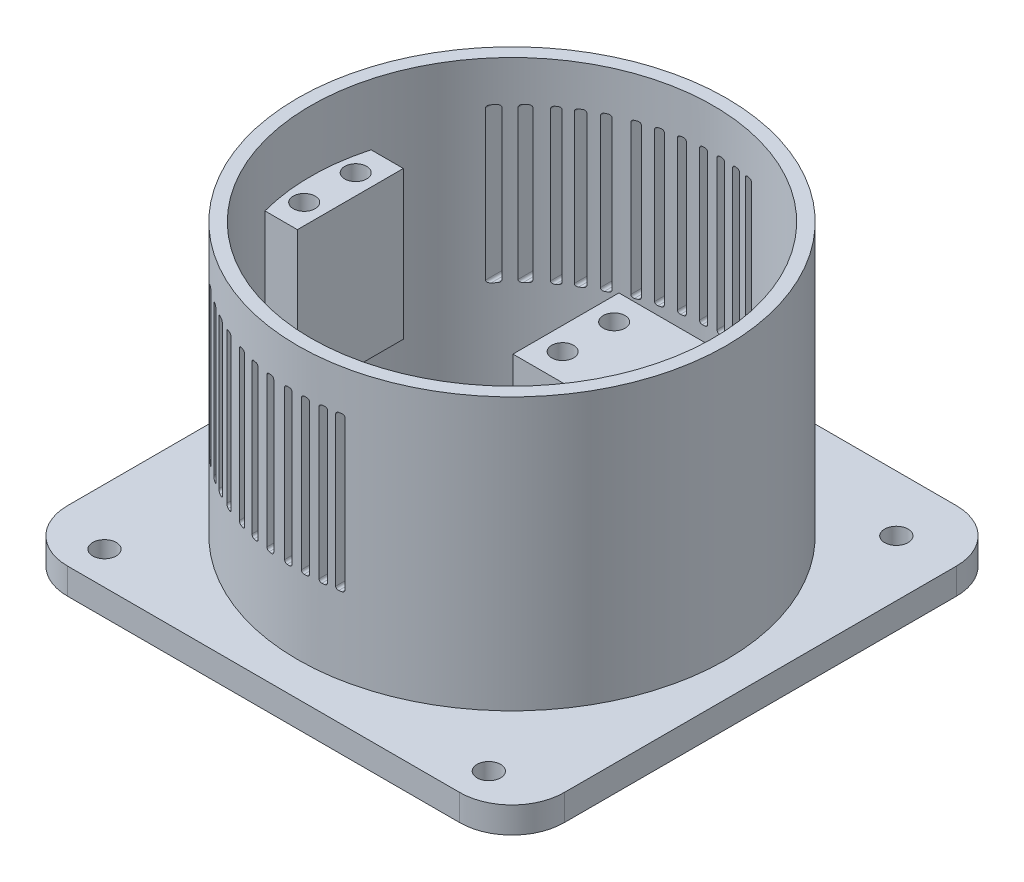
from build123d import *

# Parameters (mm, degrees)
SKETCH1_R               = 2.25
BOSS_EXTRUDE1_DEPTH     = 5
SKETCH2_R               = 41
BOSS_EXTRUDE2_DEPTH     = 52
SKETCH3_R               = 38.5
CUT_EXTRUDE1_DEPTH      = 89.099375707
BOSS_EXTRUDE3_START     = 28.28
BOSS_EXTRUDE3_DEPTH     = 28.28
SKETCH5_R               = 2.1
CUT_EXTRUDE2_DEPTH      = 5.5
SKETCH6_W               = 13.431108964
SKETCH6_H               = 20.261863373
CUT_EXTRUDE3_DEPTH      = 15
CHAMFER1_SIZE           = 5
FILLET2_R               = 10
CUT_EXTRUDE5_DEPTH      = 89.099375707
CUT_EXTRUDE5_DEPTH_BACK = 89.099375707


with BuildPart() as part:
    # Sketch1 → Boss-Extrude1 (new body)
    with BuildSketch(Plane(origin=(0, 0, 0), x_dir=(1, 0, 0), z_dir=(0, 1, 0))):
        with BuildLine():
            Line((37.5, 47.5), (-37.5, 47.5))
            ThreePointArc((-37.5, 47.5), (-44.571067812, 44.571067812), (-47.5, 37.5))
            Line((-47.5, 37.5), (-47.5, -37.5))
            ThreePointArc((-47.5, -37.5), (-44.571067812, -44.571067812), (-37.5, -47.5))
            Line((-37.5, -47.5), (37.5, -47.5))
            ThreePointArc((37.5, -47.5), (44.571067812, -44.571067812), (47.5, -37.5))
            Line((47.5, -37.5), (47.5, 37.5))
            ThreePointArc((47.5, 37.5), (44.571067812, 44.571067812), (37.5, 47.5))
        make_face()
        with Locations((-36.75, -41.181487247)):
            Circle(SKETCH1_R, mode=Mode.SUBTRACT)
        with Locations((36.75, -41.181487247)):
            Circle(SKETCH1_R, mode=Mode.SUBTRACT)
        with Locations((-36.75, 36.75)):
            Circle(SKETCH1_R, mode=Mode.SUBTRACT)
        with Locations((36.75, 36.75)):
            Circle(SKETCH1_R, mode=Mode.SUBTRACT)
    extrude(amount=BOSS_EXTRUDE1_DEPTH)

    # Sketch2 → Boss-Extrude2 (add)
    with BuildSketch(Plane(origin=(0, 5, 0), x_dir=(1, 0, 0), z_dir=(0, 1, 0))):
        Circle(SKETCH2_R)
    extrude(amount=BOSS_EXTRUDE2_DEPTH)

    # Sketch3 → Cut-Extrude1 (cut, through all)
    with BuildSketch(Plane(origin=(0, 57, 0), x_dir=(1, 0, 0), z_dir=(0, 1, 0))):
        Circle(SKETCH3_R)
    extrude(amount=-CUT_EXTRUDE1_DEPTH, mode=Mode.SUBTRACT)

    # Sketch4 → Boss-Extrude3 (add)
    with BuildSketch(Plane(origin=(0, 17, 0), x_dir=(1, 0, 0), z_dir=(0, 1, 0)).offset(BOSS_EXTRUDE3_START)):
        with BuildLine():
            Line((10.269191501, 10.173909465), (10.269191501, -10.087953908))
            Line((10.269191501, -10.087953908), (37.154854137, -10.087953908))
            ThreePointArc((37.154854137, -10.087953908), (38.499974227, 0.044547761), (37.131409429, 10.173909465))
            Line((37.131409429, 10.173909465), (10.269191501, 10.173909465))
        make_face()
        with BuildLine():
            Line((-37.154854137, -10.087953908), (-30.95381168, -10.087953908))
            Line((-30.95381168, -10.087953908), (-30.95381168, 10.173909465))
            Line((-30.95381168, 10.173909465), (-37.131409429, 10.173909465))
            ThreePointArc((-37.131409429, 10.173909465), (-38.499974227, 0.044547761), (-37.154854137, -10.087953908))
        make_face()
    extrude(amount=-BOSS_EXTRUDE3_DEPTH)

    # Sketch5 → Cut-Extrude2 (cut)
    with BuildSketch(Plane(origin=(0, 45.28, 0), x_dir=(1, 0, 0), z_dir=(0, 1, 0))):
        with Locations((14.611145618, 4.925)):
            Circle(SKETCH5_R)
        with Locations((14.611145618, -4.925)):
            Circle(SKETCH5_R)
        with Locations((-34.811145618, 4.925)):
            Circle(SKETCH5_R)
        with Locations((-34.811145618, -4.925)):
            Circle(SKETCH5_R)
    extrude(amount=-CUT_EXTRUDE2_DEPTH, mode=Mode.SUBTRACT)

    # Sketch6 → Cut-Extrude3 (cut)
    with BuildSketch(Plane(origin=(0, 17, 0), x_dir=(1, 0, 0), z_dir=(0, 1, 0))):
        with Locations((16.984745983, 0.042977779)):
            Rectangle(SKETCH6_W, SKETCH6_H)
    extrude(amount=CUT_EXTRUDE3_DEPTH, mode=Mode.SUBTRACT)

    # Chamfer1
    chamfer1_edges = [part.edges().sort_by_distance(p)[0] for p in [
        (10.269191501, 32, -0.042977779),
    ]]
    chamfer(chamfer1_edges, length=CHAMFER1_SIZE)

    # Fillet2
    fillet2_edges = [part.edges().sort_by_distance(p)[0] for p in [
        (15.269191501, 32, -0.042977779),
    ]]
    fillet(fillet2_edges, radius=FILLET2_R)

    # Sketch8 → Cut-Extrude5 (cut, two sides: drawn at the far end of the back side and taken through both)
    with BuildSketch(Plane.XY.offset(-CUT_EXTRUDE5_DEPTH_BACK)):
        with BuildLine():
            Line((-20.60603851, 48.741194653), (-20.60603851, 20.241194653))
            ThreePointArc((-20.60603851, 20.241194653), (-20.4595919, 19.887641263), (-20.10603851, 19.741194653))
            Line((-20.10603851, 19.741194653), (-19.60603851, 19.741194653))
            ThreePointArc((-19.60603851, 19.741194653), (-19.252485119, 19.887641263), (-19.10603851, 20.241194653))
            Line((-19.10603851, 20.241194653), (-19.10603851, 48.741194653))
            ThreePointArc((-19.10603851, 48.741194653), (-19.252485119, 49.094748044), (-19.60603851, 49.241194653))
            Line((-19.60603851, 49.241194653), (-20.10603851, 49.241194653))
            ThreePointArc((-20.10603851, 49.241194653), (-20.4595919, 49.094748044), (-20.60603851, 48.741194653))
        make_face()
        with BuildLine():
            Line((-22.797902435, 49.241194653), (-22.497902435, 49.241194653))
            ThreePointArc((-22.497902435, 49.241194653), (-22.144349044, 49.094748044), (-21.997902435, 48.741194653))
            Line((-21.997902435, 48.741194653), (-21.997902435, 20.241194653))
            ThreePointArc((-21.997902435, 20.241194653), (-22.144349044, 19.887641263), (-22.497902435, 19.741194653))
            Line((-22.497902435, 19.741194653), (-22.797902435, 19.741194653))
            ThreePointArc((-22.797902435, 19.741194653), (-23.151455826, 19.887641263), (-23.297902435, 20.241194653))
            Line((-23.297902435, 20.241194653), (-23.297902435, 48.741194653))
            ThreePointArc((-23.297902435, 48.741194653), (-23.151455826, 49.094748044), (-22.797902435, 49.241194653))
        make_face()
        with BuildLine():
            Line((-17.426599912, 48.741194653), (-17.426599912, 20.241194653))
            ThreePointArc((-17.426599912, 20.241194653), (-17.280153302, 19.887641263), (-16.926599912, 19.741194653))
            Line((-16.926599912, 19.741194653), (-16.426599912, 19.741194653))
            ThreePointArc((-16.426599912, 19.741194653), (-16.073046521, 19.887641263), (-15.926599912, 20.241194653))
            Line((-15.926599912, 20.241194653), (-15.926599912, 48.741194653))
            ThreePointArc((-15.926599912, 48.741194653), (-16.073046521, 49.094748044), (-16.426599912, 49.241194653))
            Line((-16.426599912, 49.241194653), (-16.926599912, 49.241194653))
            ThreePointArc((-16.926599912, 49.241194653), (-17.280153302, 49.094748044), (-17.426599912, 48.741194653))
        make_face()
        with BuildLine():
            Line((-13.380750411, 48.741194653), (-13.380750411, 20.241194653))
            ThreePointArc((-13.380750411, 20.241194653), (-13.234303801, 19.887641263), (-12.880750411, 19.741194653))
            Line((-12.880750411, 19.741194653), (-12.380750411, 19.741194653))
            ThreePointArc((-12.380750411, 19.741194653), (-12.02719702, 19.887641263), (-11.880750411, 20.241194653))
            Line((-11.880750411, 20.241194653), (-11.880750411, 48.741194653))
            ThreePointArc((-11.880750411, 48.741194653), (-12.02719702, 49.094748044), (-12.380750411, 49.241194653))
            Line((-12.380750411, 49.241194653), (-12.880750411, 49.241194653))
            ThreePointArc((-12.880750411, 49.241194653), (-13.234303801, 49.094748044), (-13.380750411, 48.741194653))
        make_face()
        with BuildLine():
            Line((-9.933418446, 48.741194653), (-9.933418446, 20.241194653))
            ThreePointArc((-9.933418446, 20.241194653), (-9.786971836, 19.887641263), (-9.433418446, 19.741194653))
            Line((-9.433418446, 19.741194653), (-8.933418446, 19.741194653))
            ThreePointArc((-8.933418446, 19.741194653), (-8.579865055, 19.887641263), (-8.433418446, 20.241194653))
            Line((-8.433418446, 20.241194653), (-8.433418446, 48.741194653))
            ThreePointArc((-8.433418446, 48.741194653), (-8.579865055, 49.094748044), (-8.933418446, 49.241194653))
            Line((-8.933418446, 49.241194653), (-9.433418446, 49.241194653))
            ThreePointArc((-9.433418446, 49.241194653), (-9.786971836, 49.094748044), (-9.933418446, 48.741194653))
        make_face()
        with BuildLine():
            Line((-6.342665463, 48.741194653), (-6.342665463, 20.241194653))
            ThreePointArc((-6.342665463, 20.241194653), (-6.196218854, 19.887641263), (-5.842665463, 19.741194653))
            Line((-5.842665463, 19.741194653), (-5.342665463, 19.741194653))
            ThreePointArc((-5.342665463, 19.741194653), (-4.989112073, 19.887641263), (-4.842665463, 20.241194653))
            Line((-4.842665463, 20.241194653), (-4.842665463, 48.741194653))
            ThreePointArc((-4.842665463, 48.741194653), (-4.989112073, 49.094748044), (-5.342665463, 49.241194653))
            Line((-5.342665463, 49.241194653), (-5.842665463, 49.241194653))
            ThreePointArc((-5.842665463, 49.241194653), (-6.196218854, 49.094748044), (-6.342665463, 48.741194653))
        make_face()
        with BuildLine():
            Line((-2.560004374, 48.741194653), (-2.560004374, 20.241194653))
            ThreePointArc((-2.560004374, 20.241194653), (-2.413557765, 19.887641263), (-2.060004374, 19.741194653))
            Line((-2.060004374, 19.741194653), (-1.560004374, 19.741194653))
            ThreePointArc((-1.560004374, 19.741194653), (-1.206450983, 19.887641263), (-1.060004374, 20.241194653))
            Line((-1.060004374, 20.241194653), (-1.060004374, 48.741194653))
            ThreePointArc((-1.060004374, 48.741194653), (-1.206450983, 49.094748044), (-1.560004374, 49.241194653))
            Line((-1.560004374, 49.241194653), (-2.060004374, 49.241194653))
            ThreePointArc((-2.060004374, 49.241194653), (-2.413557765, 49.094748044), (-2.560004374, 48.741194653))
        make_face()
        with BuildLine():
            Line((0.720931239, 48.741194653), (0.720931239, 20.241194653))
            ThreePointArc((0.720931239, 20.241194653), (0.867377849, 19.887641263), (1.220931239, 19.741194653))
            Line((1.220931239, 19.741194653), (1.720931239, 19.741194653))
            ThreePointArc((1.720931239, 19.741194653), (2.07448463, 19.887641263), (2.220931239, 20.241194653))
            Line((2.220931239, 20.241194653), (2.220931239, 48.741194653))
            ThreePointArc((2.220931239, 48.741194653), (2.07448463, 49.094748044), (1.720931239, 49.241194653))
            Line((1.720931239, 49.241194653), (1.220931239, 49.241194653))
            ThreePointArc((1.220931239, 49.241194653), (0.867377849, 49.094748044), (0.720931239, 48.741194653))
        make_face()
        with BuildLine():
            Line((3.898085563, 48.741194653), (3.898085563, 20.241194653))
            ThreePointArc((3.898085563, 20.241194653), (4.044532173, 19.887641263), (4.398085563, 19.741194653))
            Line((4.398085563, 19.741194653), (4.898085563, 19.741194653))
            ThreePointArc((4.898085563, 19.741194653), (5.251638954, 19.887641263), (5.398085563, 20.241194653))
            Line((5.398085563, 20.241194653), (5.398085563, 48.741194653))
            ThreePointArc((5.398085563, 48.741194653), (5.251638954, 49.094748044), (4.898085563, 49.241194653))
            Line((4.898085563, 49.241194653), (4.398085563, 49.241194653))
            ThreePointArc((4.398085563, 49.241194653), (4.044532173, 49.094748044), (3.898085563, 48.741194653))
        make_face()
        with BuildLine():
            Line((6.724350375, 48.741194653), (6.724350375, 20.241194653))
            ThreePointArc((6.724350375, 20.241194653), (6.870796984, 19.887641263), (7.224350375, 19.741194653))
            Line((7.224350375, 19.741194653), (7.724350375, 19.741194653))
            ThreePointArc((7.724350375, 19.741194653), (8.077903766, 19.887641263), (8.224350375, 20.241194653))
            Line((8.224350375, 20.241194653), (8.224350375, 48.741194653))
            ThreePointArc((8.224350375, 48.741194653), (8.077903766, 49.094748044), (7.724350375, 49.241194653))
            Line((7.724350375, 49.241194653), (7.224350375, 49.241194653))
            ThreePointArc((7.224350375, 49.241194653), (6.870796984, 49.094748044), (6.724350375, 48.741194653))
        make_face()
        with BuildLine():
            Line((-25.649632991, 49.241194653), (-26.149632991, 49.241194653))
            ThreePointArc((-26.149632991, 49.241194653), (-26.503186382, 49.094748044), (-26.649632991, 48.741194653))
            Line((-26.649632991, 48.741194653), (-26.649632991, 20.241194653))
            ThreePointArc((-26.649632991, 20.241194653), (-26.503186382, 19.887641263), (-26.149632991, 19.741194653))
            Line((-26.149632991, 19.741194653), (-25.649632991, 19.741194653))
            ThreePointArc((-25.649632991, 19.741194653), (-25.296079601, 19.887641263), (-25.149632991, 20.241194653))
            Line((-25.149632991, 20.241194653), (-25.149632991, 48.741194653))
            ThreePointArc((-25.149632991, 48.741194653), (-25.296079601, 49.094748044), (-25.649632991, 49.241194653))
        make_face()
        with BuildLine():
            Line((-28.649632991, 49.241194653), (-29.149632991, 49.241194653))
            ThreePointArc((-29.149632991, 49.241194653), (-29.503186382, 49.094748044), (-29.649632991, 48.741194653))
            Line((-29.649632991, 48.741194653), (-29.649632991, 20.241194653))
            ThreePointArc((-29.649632991, 20.241194653), (-29.503186382, 19.887641263), (-29.149632991, 19.741194653))
            Line((-29.149632991, 19.741194653), (-28.649632991, 19.741194653))
            ThreePointArc((-28.649632991, 19.741194653), (-28.296079601, 19.887641263), (-28.149632991, 20.241194653))
            Line((-28.149632991, 20.241194653), (-28.149632991, 48.741194653))
            ThreePointArc((-28.149632991, 48.741194653), (-28.296079601, 49.094748044), (-28.649632991, 49.241194653))
        make_face()
    extrude(amount=CUT_EXTRUDE5_DEPTH + CUT_EXTRUDE5_DEPTH_BACK, mode=Mode.SUBTRACT)


solid = part.part
